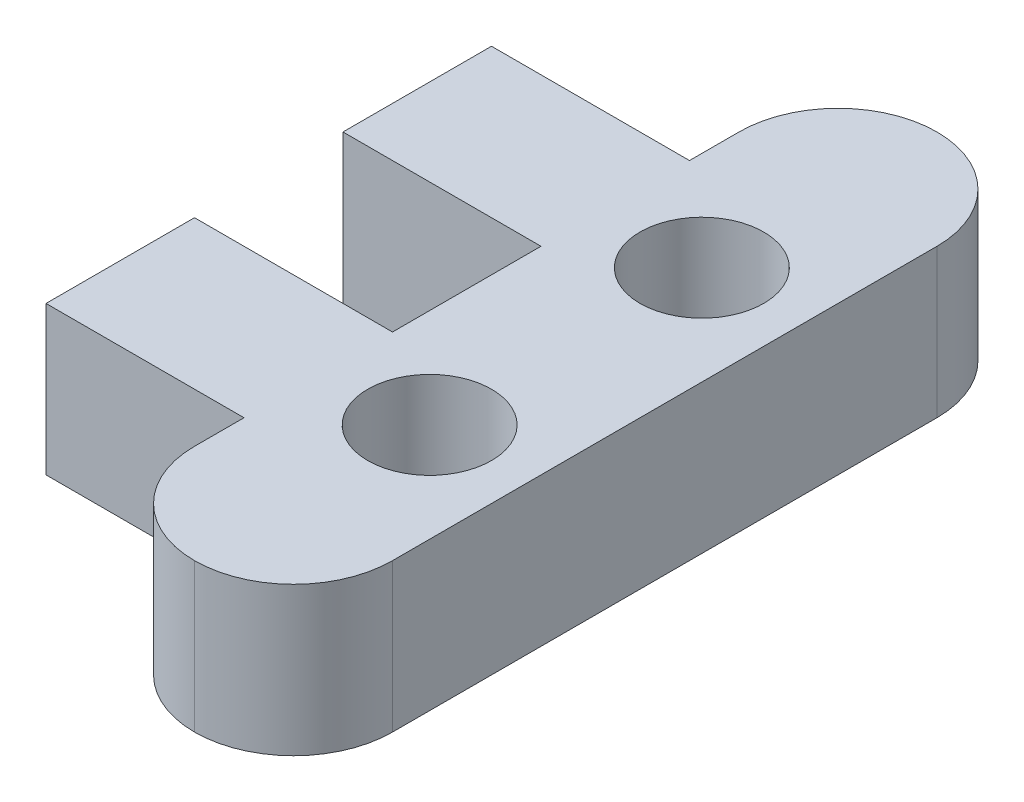
from build123d import *

# Parameters (mm, degrees)
SKETCH1_R           = 2.5
BOSS_EXTRUDE1_DEPTH = 6
FILLET1_R           = 4


with BuildPart() as part:
    # Sketch1 → Boss-Extrude1 (new body)
    with BuildSketch(Plane(origin=(0, 0, 0), x_dir=(1, 0, 0), z_dir=(0, 1, 0))):
        Polygon((-4, 14.999990394), (-4, 8.999990394), (-12, 8.999990394), (-12, 2.999990394), (-4, 2.999990394), (-4, -3.000009606), (-12, -3.000009606), (-12, -9.000009606), (-4, -9.000009606), (-4, -15.000009606), (4, -15.000009606), (4, 14.999990394), align=None)
        with Locations(Location((0, 5.5, 0), (0, 0, 270))):
            Circle(SKETCH1_R, mode=Mode.SUBTRACT)
        with Locations(Location((0, -5.5, 0), (0, 0, 270))):
            Circle(SKETCH1_R, mode=Mode.SUBTRACT)
    extrude(amount=BOSS_EXTRUDE1_DEPTH)

    # Fillet1
    fillet1_edges = [part.edges().sort_by_distance(p)[0] for p in [
        (-4, 3, 15.000009606),
        (-4, 3, -14.999990394),
        (4, 3, 15.000009606),
        (4, 3, -14.999990394),
    ]]
    fillet(fillet1_edges, radius=FILLET1_R - 0.0001)  # a hair under: the kernel refuses the full size


solid = part.part
